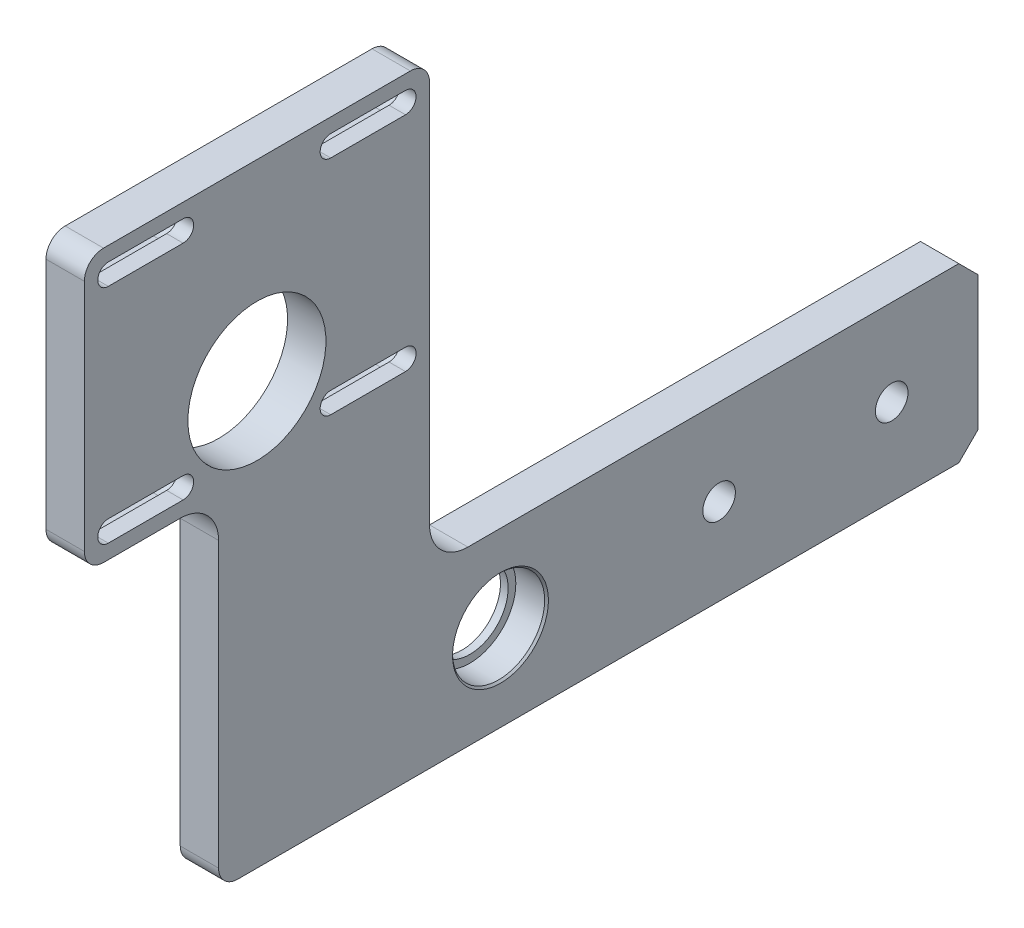
from build123d import *

# Parameters (mm, degrees)
EXTRUDE_1_OUTLINE_W     = 2
EXTRUDE_1_OUTLINE_H     = 2
EXTRUDE_START           = -5
EXTRUDE_1_2_OUTLINE_R   = 4.25
EXTRUDE_1_2_OUTLINE_R_2 = 12
EXTRUDE_1_2_DEPTH       = 10
SKETCH_2_W              = 80
SKETCH_2_H              = 71
EXTRUDE_2_DEPTH         = 10
HOLE_START              = -6
HOLE_WIZARD_4_DEPTH     = 6.7
HOLE_START_2            = 0.7
HOLE_WIZARD_4_2_DEPTH   = 5.3
SKETCH_7_R              = 18
CUT_EXTRUDE_1_DEPTH     = 10
FILLET_2_R              = 5
FILLET_3_R              = 5
SKETCH_8_W              = 52.674698886
SKETCH_8_H              = 88.999999996
EXTRUDE_3_DEPTH         = 10
SKETCH_9_W              = 90.000000011
SKETCH_9_H              = 126.81088124
CUT_EXTRUDE_2_DEPTH     = 10
FILLET_4_R              = 10
FILLET_6_R              = 5


with BuildPart() as part:
    # 凸台-拉伸1: read off the stored shape, not the designer's step
    # 凸台-拉伸1 outline → 凸台-拉伸1 (revolve)
    with BuildSketch(Plane(origin=(0, -22.5, -28.5), x_dir=(0, 1, 0), z_dir=(0, 0, -1))):
        with Locations((11, -4)):
            Rectangle(EXTRUDE_1_OUTLINE_W, EXTRUDE_1_OUTLINE_H)
    revolve(axis=Axis((0, -22.5, -28.5), (1, 0, 0)))

    # Extrude 1 2 outline → Extrude 1 2 (add)
    with BuildSketch(Plane.YZ.offset(EXTRUDE_START)):
        with BuildLine():
            Line((114.999999996, 0), (-40, 0))
            ThreePointArc((-40, 0), (-43.535533906, -1.464466094), (-45, -5))
            Line((-45, -5), (-45, -148))
            Line((-45, -148), (-40, -153))
            Line((-40, -153), (-5, -153))
            Line((-5, -153), (1.7e-08, -147.999999983))
            Line((1.7e-08, -147.999999983), (0, -100))
            ThreePointArc((0, -100), (2.928932188, -92.928932188), (10, -90))
            Line((10, -90), (114.999999996, -90))
            Line((114.999999996, -90), (114.999999996, 0))
        make_face()
        with Locations((-22.5, -130.5)):
            Circle(EXTRUDE_1_2_OUTLINE_R, mode=Mode.SUBTRACT)
        with Locations((-22.5, -85.5)):
            Circle(EXTRUDE_1_2_OUTLINE_R, mode=Mode.SUBTRACT)
        with Locations((-22.5, -28.5)):
            Circle(EXTRUDE_1_2_OUTLINE_R_2, mode=Mode.SUBTRACT)
    extrude(amount=EXTRUDE_1_2_DEPTH)

    # Extrude 1 3 outline → Extrude 1 3 (revolve, cut)
    with BuildSketch(Plane(origin=(0, -22.5, -28.5), x_dir=(0, 1, 0), z_dir=(0, 0, -1))):
        Polygon((12, 5), (12, 4.5), (12.5, 5), align=None)
    revolve(axis=Axis((0, -22.5, -28.5), (1, 0, 0)), mode=Mode.SUBTRACT)

    # 草图2 → 凸台-拉伸2 (add)
    with BuildSketch(Plane.ZY.offset(5)):
        with Locations((40, 79.499999996)):
            Rectangle(SKETCH_2_W, SKETCH_2_H)
    extrude(amount=-EXTRUDE_2_DEPTH)

    # 打孔尺寸(%根据)内六角圆柱头螺钉的类型4: read off the stored shape, not the designer's step
    # 打孔尺寸(%根据)内六角圆柱头螺钉的类型4 outline → 打孔尺寸(%根据)内六角圆柱头螺钉的类型4 (cut)
    with BuildSketch(Plane.YZ.offset(HOLE_START)):
        with BuildLine():
            ThreePointArc((45.508621967, -3.732756057), (50.508621967, -8.732756057), (55.508621967, -3.732756057))
            Line((55.508621967, -3.732756057), (55.508621967, 15.767243943))
            ThreePointArc((55.508621967, 15.767243943), (50.508621967, 20.767243943), (45.508621967, 15.767243943))
            Line((45.508621967, 15.767243943), (45.508621967, -3.732756057))
        make_face()
        with BuildLine():
            ThreePointArc((55.508621967, 73.75), (50.508621967, 78.75), (45.508621967, 73.75))
            Line((45.508621967, 73.75), (45.508621967, 54.25))
            ThreePointArc((45.508621967, 54.25), (50.508621967, 49.25), (55.508621967, 54.25))
            Line((55.508621967, 54.25), (55.508621967, 73.75))
        make_face()
        with BuildLine():
            ThreePointArc((103.491378024, 54.25), (108.491378024, 49.25), (113.491378024, 54.25))
            Line((113.491378024, 54.25), (113.491378024, 73.75))
            ThreePointArc((113.491378024, 73.75), (108.491378024, 78.75), (103.491378024, 73.75))
            Line((103.491378024, 73.75), (103.491378024, 54.25))
        make_face()
        with BuildLine():
            ThreePointArc((113.491378024, 15.767243943), (108.491378024, 20.767243943), (103.491378024, 15.767243943))
            Line((103.491378024, 15.767243943), (103.491378024, -3.732756057))
            ThreePointArc((103.491378024, -3.732756057), (108.491378024, -8.732756057), (113.491378024, -3.732756057))
            Line((113.491378024, -3.732756057), (113.491378024, 15.767243943))
        make_face()
    extrude(amount=HOLE_WIZARD_4_DEPTH, mode=Mode.SUBTRACT)

    # Hole Wizard 4 2 outline → Hole Wizard 4 2 (cut)
    with BuildSketch(Plane.YZ.offset(HOLE_START_2)):
        with BuildLine():
            ThreePointArc((47.758621967, -3.732756057), (50.508621967, -6.482756057), (53.258621967, -3.732756057))
            Line((53.258621967, -3.732756057), (53.258621967, 15.767243943))
            ThreePointArc((53.258621967, 15.767243943), (50.508621967, 18.517243943), (47.758621967, 15.767243943))
            Line((47.758621967, 15.767243943), (47.758621967, -3.732756057))
        make_face()
        with BuildLine():
            ThreePointArc((53.258621967, 73.75), (50.508621967, 76.5), (47.758621967, 73.75))
            Line((47.758621967, 73.75), (47.758621967, 54.25))
            ThreePointArc((47.758621967, 54.25), (50.508621967, 51.5), (53.258621967, 54.25))
            Line((53.258621967, 54.25), (53.258621967, 73.75))
        make_face()
        with BuildLine():
            ThreePointArc((105.741378024, 54.25), (108.491378024, 51.5), (111.241378024, 54.25))
            Line((111.241378024, 54.25), (111.241378024, 73.75))
            ThreePointArc((111.241378024, 73.75), (108.491378024, 76.5), (105.741378024, 73.75))
            Line((105.741378024, 73.75), (105.741378024, 54.25))
        make_face()
        with BuildLine():
            ThreePointArc((111.241378024, 15.767243943), (108.491378024, 18.517243943), (105.741378024, 15.767243943))
            Line((105.741378024, 15.767243943), (105.741378024, -3.732756057))
            ThreePointArc((105.741378024, -3.732756057), (108.491378024, -6.482756057), (111.241378024, -3.732756057))
            Line((111.241378024, -3.732756057), (111.241378024, 15.767243943))
        make_face()
    extrude(amount=HOLE_WIZARD_4_2_DEPTH, mode=Mode.SUBTRACT)

    # 草图7 → 切除-拉伸1 (cut)
    with BuildSketch(Plane.ZY.offset(5)):
        with Locations((35.008621971, 64.999999996)):
            Circle(SKETCH_7_R)
    extrude(amount=-CUT_EXTRUDE_1_DEPTH, mode=Mode.SUBTRACT)

    # 圆角2
    fillet_2_edges = [part.edges().sort_by_distance(p)[0] for p in [
        (0, 114.999999996, -90),
        (0, 114.999999996, 80),
        (0, 43.999999996, 80),
    ]]
    fillet(fillet_2_edges, radius=FILLET_2_R)

    # 圆角3
    fillet_3_edges = [part.edges().sort_by_distance(p)[0] for p in [
        (0, 43.999999996, 0),
    ]]
    fillet(fillet_3_edges, radius=FILLET_3_R)

    # 草图8 → 凸台-拉伸3 (add)
    with BuildSketch(Plane.ZY.offset(5)):
        with Locations((18.662650557, -0.500000002)):
            Rectangle(SKETCH_8_W, SKETCH_8_H)
    extrude(amount=-EXTRUDE_3_DEPTH)

    # 草图9 → 切除-拉伸2 (cut)
    with BuildSketch(Plane.ZY.offset(5)):
        with Locations((-54.999999997, 63.40544062)):
            Rectangle(SKETCH_9_W, SKETCH_9_H)
    extrude(amount=-CUT_EXTRUDE_2_DEPTH, mode=Mode.SUBTRACT)

    # 圆角4
    fillet_4_edges = [part.edges().sort_by_distance(p)[0] for p in [
        (0, 43.999999996, 45),
        (0, 0, -9.999999991),
    ]]
    fillet(fillet_4_edges, radius=FILLET_4_R)

    # 圆角6
    fillet_6_edges = [part.edges().sort_by_distance(p)[0] for p in [
        (0, -45, 45),
        (0, 114.999999996, -9.999999991),
    ]]
    fillet(fillet_6_edges, radius=FILLET_6_R)


solid = part.part
